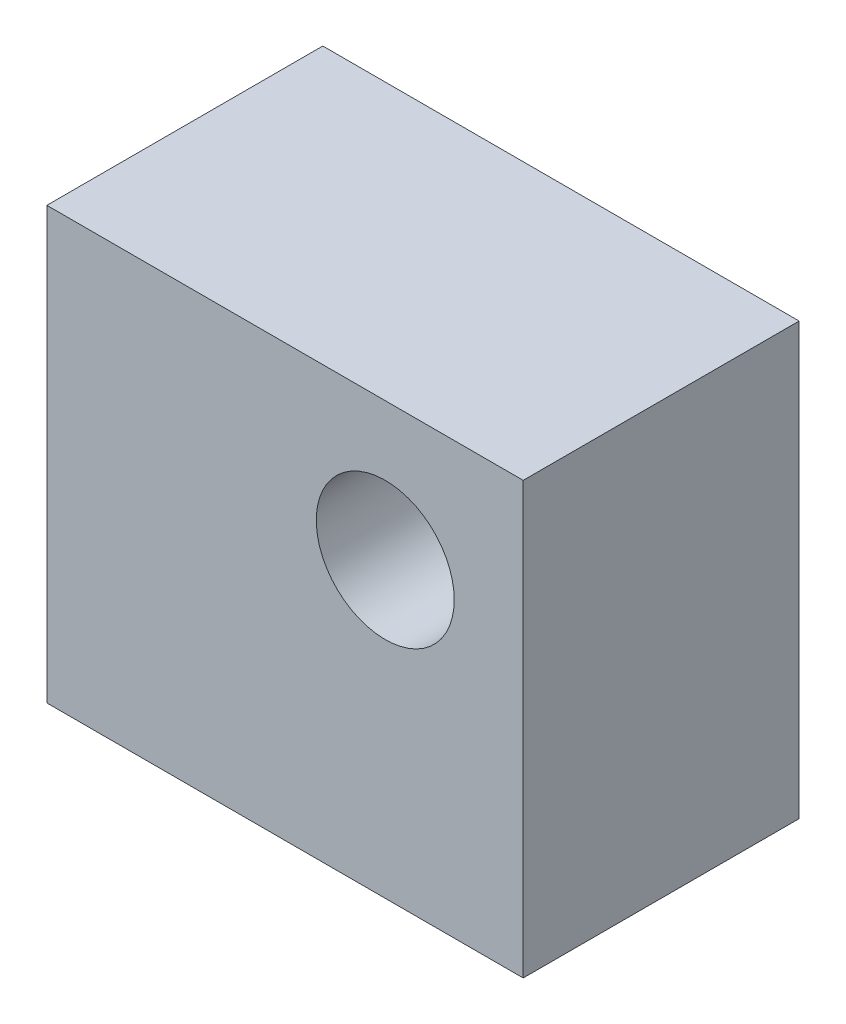
from build123d import *

# Parameters (mm, degrees)
SKETCH3_W                      = 21.924187445
SKETCH3_H                      = 19.837641971
BOSS_EXTRUDE1_DEPTH            = 6.35
SKETCH4_R                      = 3.175
CUT_EXTRUDE1_DEPTH             = 9.525
SKETCH5_R                      = 3.175
CUT_EXTRUDE5_DEPTH             = 9.525
CUT_EXTRUDE5_DIRECTION_2_REACH = 27.174
SKETCH6_R                      = 3.175
CUT_EXTRUDE6_DEPTH             = 9.525


with BuildPart() as part:
    # Sketch3 → Boss-Extrude1 (new, symmetric)
    with BuildSketch(Plane.XY):
        with Locations((10.962093723, -9.918820986)):
            Rectangle(SKETCH3_W, SKETCH3_H)
    extrude(amount=BOSS_EXTRUDE1_DEPTH, both=True)

    # Sketch4 → Cut-Extrude1 (cut)
    with BuildSketch(Plane.ZY):
        with Locations((0, -6.35)):
            Circle(SKETCH4_R)
    extrude(amount=-CUT_EXTRUDE1_DEPTH, mode=Mode.SUBTRACT)

    # Sketch5 → Cut-Extrude5 (cut)
    with BuildSketch(Plane(origin=(7.787093723, -19.837641971, 0), x_dir=(-0.8660254037844382, 0.500000000000001, 0), z_dir=(-0.500000000000001, -0.8660254037844382, 0))):
        Circle(SKETCH5_R)
    extrude(amount=-CUT_EXTRUDE5_DEPTH, mode=Mode.SUBTRACT)

    # Sketch5 → Cut-Extrude5 direction 2 (cut, up to next)
    with BuildSketch(Plane(origin=(7.787093723, -19.837641971, 0), x_dir=(-0.8660254037844382, 0.500000000000001, 0), z_dir=(-0.500000000000001, -0.8660254037844382, 0)), mode=Mode.PRIVATE) as cut_extrude5_direction_2_sk1:
        Circle(SKETCH5_R)
    cut_extrude5_direction_2_tool1 = extrude(cut_extrude5_direction_2_sk1.sketch, amount=CUT_EXTRUDE5_DIRECTION_2_REACH, mode=Mode.PRIVATE) & part.part
    add(cut_extrude5_direction_2_tool1.solids().sort_by_distance((7.787094, -19.837642, 0))[0], mode=Mode.SUBTRACT)

    # Sketch6 → Cut-Extrude6 (cut)
    with BuildSketch(Plane(origin=(0, 0, 6.35), x_dir=(-1, 0, 0), z_dir=(0, 0, -1))):
        with Locations((-15.574187445, -6.35)):
            Circle(SKETCH6_R)
    extrude(amount=CUT_EXTRUDE6_DEPTH, mode=Mode.SUBTRACT)


solid = part.part
